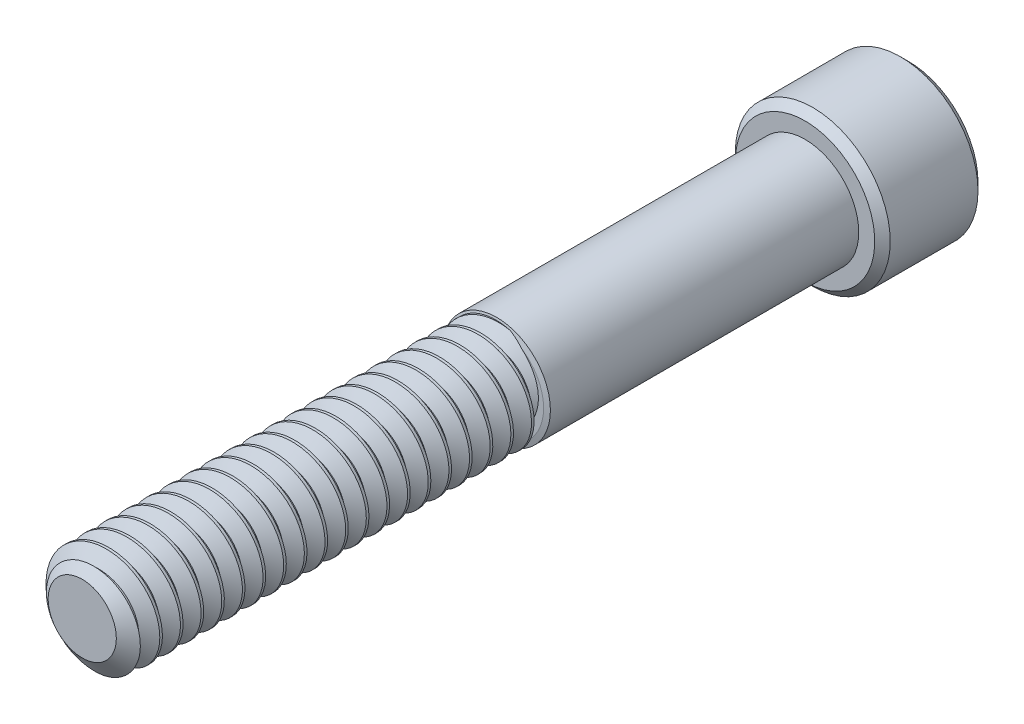
from build123d import *

# Parameters (mm, degrees)
SKETCH1_R          = 3.175
EXTRUDE1_DEPTH     = 44.45
CUT_SWEEP1_PITCH   = 1.27
SKETCH6_R          = 4.7625
EXTRUDE2_DEPTH     = 6.35
CUT_EXTRUDE1_DEPTH = 3.571875
CHAMFER1_SIZE      = 0.47625


with BuildPart() as part:
    # Sketch1 → Extrude1 (new body)
    with BuildSketch(Plane.XY):
        Circle(SKETCH1_R)
    extrude(amount=-EXTRUDE1_DEPTH)

    # Cut-Sweep1: the profile of Sketch3 profile screwed along a right-hand helix of 36 turns, 6 arcs to a turn; built about Z, then put on its axis
    cut_sweep1_z = Axis((0, 0, 0), (0, 0, 1))
    cut_sweep1_corners = [(3.1753, 0, -1.111423205), (2.350110803, 0, -0.635), (2.350110803, 0, -0.47625), (3.1753, 0, 0.000173205)]
    with BuildLine(mode=Mode.PRIVATE) as cut_sweep1_profile:
        Line(cut_sweep1_corners[0], cut_sweep1_corners[1])
        Line(cut_sweep1_corners[1], cut_sweep1_corners[2])
        Line(cut_sweep1_corners[2], cut_sweep1_corners[3])
        Line(cut_sweep1_corners[3], cut_sweep1_corners[0])
    cut_sweep1_cap = Face(cut_sweep1_profile.wire())
    cut_sweep1_turn_angles = [0, 30, 60, 90, 120, 150, 180, 210, 240, 270, 300, 330, 360]
    cut_sweep1_turn_weights = [1, 0.8660254037844387, 1, 0.8660254037844387, 1, 0.8660254037844387, 1, 0.8660254037844387, 1, 0.8660254037844387, 1, 0.8660254037844387, 1]
    cut_sweep1_turn_rails = [Edge.make_bspline([Vector(p[0], p[1], 0).rotate(cut_sweep1_z, cut_sweep1_turn_angles[k]) / cut_sweep1_turn_weights[k] + Vector(0, 0, p[2] + CUT_SWEEP1_PITCH * cut_sweep1_turn_angles[k] / 360) for k in range(13)], [0, 0, 0, 1, 1, 2, 2, 3, 3, 4, 4, 5, 5, 6, 6, 6], 2, cut_sweep1_turn_weights) for p in cut_sweep1_corners]
    cut_sweep1_turn_sides = [Face.make_surface_from_curves(cut_sweep1_turn_rails[p[0]], cut_sweep1_turn_rails[p[1]]) for p in [(0, 1), (1, 2), (2, 3), (3, 0)]]
    cut_sweep1 = Plane(origin=(0, 0, 0), x_dir=(0, 1, 0), z_dir=(0, 0, -1)) * Solid(Shell([*[p.moved(Location((0, 0, CUT_SWEEP1_PITCH * i))) for i in range(36) for p in cut_sweep1_turn_sides], cut_sweep1_cap, cut_sweep1_cap.rotate(cut_sweep1_z, 12960).moved(Location((0, 0, CUT_SWEEP1_PITCH * 12960 / 360)))]))
    add(cut_sweep1, mode=Mode.SUBTRACT)

    # Sketch4 → Cut-Revolve1 (revolve, cut)
    with BuildSketch(Plane(origin=(0, 0, 0), x_dir=(0, 0, -1), z_dir=(1, 0, 0)), mode=Mode.PRIVATE) as cut_revolve1_sk:
        Polygon((0.755446349, 3.175), (0, 2.096110803), (0, 3.175), align=None)
    revolve(cut_revolve1_sk.sketch.rotate(Axis((0, 0, 0), (0, 0, -1)), 90), axis=Axis((0, 0, 0), (0, 0, -1)), mode=Mode.SUBTRACT)

    # Sketch5 → partially thread (revolve)
    with BuildSketch(Plane(origin=(0, 0, 0), x_dir=(0, 0, -1), z_dir=(1, 0, 0)), mode=Mode.PRIVATE) as partially_thread_sk:
        Polygon((44.45, 3.302), (25.488476823, 3.302), (25.4, 2.9718), (25.4, 0), (44.45, 0), align=None)
    revolve(partially_thread_sk.sketch.rotate(Axis((0, 0, 0), (0, 0, -1)), 90), axis=Axis((0, 0, 0), (0, 0, -1)))

    # Sketch6 → Extrude2 (add)
    with BuildSketch(Plane(origin=(0, 0, -44.45), x_dir=(-1, 0, 0), z_dir=(0, 0, -1))):
        with Locations(Location((0, 0, 0), (0, 0, 180))):
            Circle(SKETCH6_R)
    extrude(amount=EXTRUDE2_DEPTH)

    # Sketch7 → Cut-Extrude1 (cut)
    with BuildSketch(Plane(origin=(0, 0, -50.8), x_dir=(-1, 0, 0), z_dir=(0, 0, -1))):
        Polygon((0, 2.749630657), (-2.38125, 1.374815329), (-2.38125, -1.374815329), (0, -2.749630657), (2.38125, -1.374815329), (2.38125, 1.374815329), align=None)
    extrude(amount=-CUT_EXTRUDE1_DEPTH, mode=Mode.SUBTRACT)

    # Cut-Extrude2 cone 1 section (through the dimple's axis) → Cut-Extrude2 (revolve, cut)
    with BuildSketch(Plane(origin=(0, 0, -50.8), x_dir=(0, 1, 0), z_dir=(1, 0, 0))):
        Polygon((0, 0), (2.749630657, 0), (0, 2.749630657), align=None)
    revolve(axis=Axis((0, 0, -50.8), (0, 0, 1)), mode=Mode.SUBTRACT)

    # Chamfer1
    chamfer1_edges = [part.edges().sort_by_distance(p)[0] for p in [
        (-4.7625, 0, -44.45),
        (-4.7625, 0, -50.8),
    ]]
    chamfer(chamfer1_edges, length=CHAMFER1_SIZE)


solid = part.part
